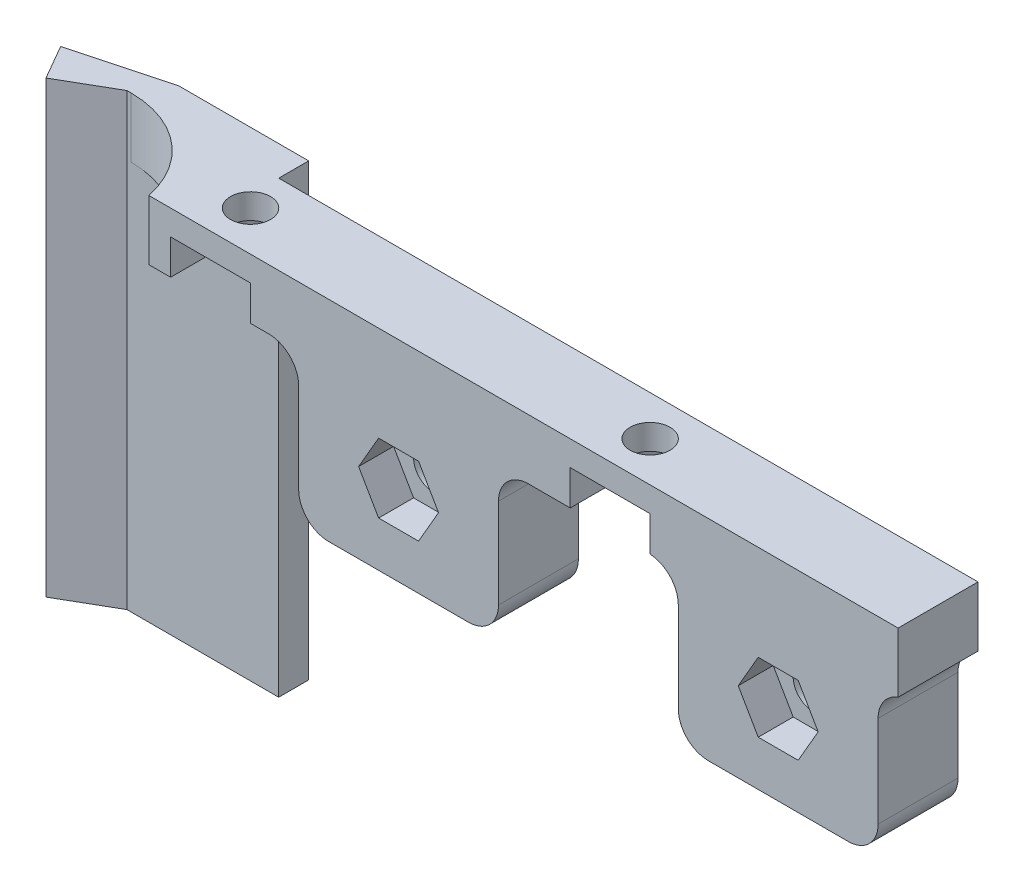
from build123d import *

# Parameters (mm, degrees)
ESQUISSE1_R             = 2
BOSS_EXTRU_1_DEPTH      = 45
ESQUISSE2_W             = 75
ESQUISSE2_H             = 39
ENL_V_MAT_EXTRU_1_DEPTH = 8
ENL_V_MAT_EXTRU_2_DEPTH = 3.5
CONG_1_R                = 10
ESQUISSE4_W             = 20
ESQUISSE4_H             = 8
BOSS_EXTRU_2_DEPTH      = 15
CONG_3_R                = 3
ENL_V_MAT_EXTRU_3_DEPTH = 3.5
ESQUISSE6_R             = 2
ENL_V_MAT_EXTRU_4_DEPTH = 91.936473524


with BuildPart() as part:
    # Esquisse1 → Boss.-Extru.1 (new body)
    with BuildSketch(Plane(origin=(0, 0, 0), x_dir=(1, 0, 0), z_dir=(0, 1, 0))):
        Polygon((-13.665063509, 0.5), (-11.665063509, -2.964101615), (-6.531088913, 0), (3.665063509, 0), (3.665063509, -8), (78.665063509, -8), (78.665063509, 0), (8.665063509, 0), (8.665063509, 3), (-4.334936491, 3), align=None)
        with Locations(Location((49.844555434, -4, 0), (0, 0, 90))):
            Circle(ESQUISSE1_R, mode=Mode.SUBTRACT)
        with Locations(Location((9.844555434, -4, 0), (0, 0, 90))):
            Circle(ESQUISSE1_R, mode=Mode.SUBTRACT)
    extrude(amount=BOSS_EXTRU_1_DEPTH)

    # Esquisse2 → Enlèv. mat.-Extru.1 (cut)
    with BuildSketch(Plane.XY.offset(8)):
        with Locations((41.165063509, 19.5)):
            Rectangle(ESQUISSE2_W, ESQUISSE2_H)
    extrude(amount=-ENL_V_MAT_EXTRU_1_DEPTH, mode=Mode.SUBTRACT)

    # Esquisse3 → Enlèv. mat.-Extru.2 (cut)
    with BuildSketch(Plane.XZ.offset(-39)):
        Polygon((51.844555434, 0.535898385), (47.844555434, 0.535898385), (45.844555434, 4), (45.844555434, 8), (53.844555434, 8), (53.844555434, 4), align=None)
        Polygon((11.844555434, 0.535898385), (7.844555434, 0.535898385), (5.844555434, 4), (5.844555434, 8), (13.844555434, 8), (13.844555434, 4), align=None)
    extrude(amount=-ENL_V_MAT_EXTRU_2_DEPTH, mode=Mode.SUBTRACT)

    # Congé1
    # the kernel refuses this fillet: 10 mm, written as the material it adds along each edge
    with BuildSketch(Plane(origin=(3.665063509, 39, 0), x_dir=(-1, 0, 0), z_dir=(0, 1, 0))) as cong_1_piece_1:
        with BuildLine():
            CenterArc((9.797958971, 10), CONG_1_R, 191.536959033, 78.463040967)
            Line((0, 8), (-0.195959179, 7.96))
            ThreePointArc((-0.195959179, 7.96), (-0.2, 4), (-0.2, 0))
            Line((-0.2, 0), (0, -0.2))
            Line((0, -0.2), (9.797958971, -0.2))
            Line((9.797958971, -0.2), (9.797958971, 0))
        make_face()
    extrude(amount=6)

    # Esquisse4 → Boss.-Extru.2 (add)
    with BuildSketch(Plane.XZ.offset(-39)):
        with Locations((28.665063509, 4)):
            Rectangle(ESQUISSE4_W, ESQUISSE4_H)
        with Locations((66.665063509, 4)):
            Rectangle(ESQUISSE4_W, ESQUISSE4_H)
    extrude(amount=BOSS_EXTRU_2_DEPTH)

    # Congé3
    # the kernel refuses this fillet: 3 mm, written as the material it adds along each edge
    with BuildSketch(Plane(origin=(18.665063509, 39, 0), x_dir=(-1, 0, 0), z_dir=(0, 0, 1)), Plane(origin=(38.665063509, 39, 8), x_dir=(1, 0, 0), z_dir=(0, 0, -1))) as cong_3_piece_1:
        with BuildLine():
            CenterArc((CONG_3_R, CONG_3_R), CONG_3_R, 180, 90)
            Line((0, CONG_3_R), (0, 0))
            Line((0, 0), (CONG_3_R, 0))
        make_face()
    extrude(amount=8)
    with BuildSketch(Plane(origin=(76.665063509, 39, 8), x_dir=(1, 0, 0), z_dir=(0, 0, -1))) as cong_3_piece_2:
        with BuildLine():
            CenterArc((3, 2.828427125), CONG_3_R, 180, 70.528779366)
            Line((0, 2.828427125), (0, 0))
            Line((0, 0), (2, 0))
        make_face()
    extrude(amount=8)
    with BuildSketch(Plane(origin=(56.665063509, 39, 0), x_dir=(-1, 0, 0), z_dir=(0, 0, 1))) as cong_3_piece_3_section:
        with BuildLine():
            CenterArc((CONG_3_R, CONG_3_R), CONG_3_R, 180, 90)
            Line((0, CONG_3_R), (0, 0))
            Line((0, 0), (CONG_3_R, 0))
        make_face()
    cong_3_piece_3 = extrude(amount=8, mode=Mode.PRIVATE)
    cong_3_piece_3 = split(cong_3_piece_3, bisect_by=Plane(origin=(52.817631645, 39, 2.221315823), z_dir=(0.8660254037844395, 0, -0.4999999999999987)), keep=Keep.TOP, mode=Mode.PRIVATE)
    add(cong_3_piece_3)
    with BuildSketch(Plane(origin=(56.665063509, 39, -7.5), x_dir=(-1, 0, 0), z_dir=(0, 0, 1))) as cong_3_piece_4_section:
        with BuildLine():
            CenterArc((CONG_3_R, CONG_3_R), CONG_3_R, 180, 90)
            Line((0, CONG_3_R), (0, 0))
            Line((0, 0), (CONG_3_R, 0))
        make_face()
    cong_3_piece_4 = extrude(amount=15.5, mode=Mode.PRIVATE)
    cong_3_piece_4 = split(cong_3_piece_4, bisect_by=Plane(origin=(53.844555434, 39, -7.5), z_dir=(1, 0, 0)), keep=Keep.TOP, mode=Mode.PRIVATE)
    cong_3_piece_4 = split(cong_3_piece_4, bisect_by=Plane(origin=(49.570036381, 39, -3.403684177), z_dir=(-0.8660254037844395, 0, 0.4999999999999987)), keep=Keep.TOP, mode=Mode.PRIVATE)
    add(cong_3_piece_4)
    # the kernel refuses this fillet: 3 mm, written as the material it takes off along each edge
    with BuildSketch(Plane(origin=(76.665063509, 24, 15.5), x_dir=(-1, 0, 0), z_dir=(0, 0, -1)), Plane(origin=(18.665063509, 24, -7.5), x_dir=(1, 0, 0), z_dir=(0, 0, 1))) as cong_3_2_piece_1:
        with BuildLine():
            CenterArc((CONG_3_R, CONG_3_R), CONG_3_R, 180, 90)
            Line((0, CONG_3_R), (0, 0))
            Line((0, 0), (CONG_3_R, 0))
        make_face()
    extrude(amount=23, mode=Mode.SUBTRACT)
    with BuildSketch(Plane(origin=(56.665063509, 24, -7.5), x_dir=(0, 1, 0), z_dir=(0, 0, 1)), Plane(origin=(38.665063509, 24, 15.5), x_dir=(0, 1, 0), z_dir=(0, 0, -1))) as cong_3_2_piece_2:
        with BuildLine():
            CenterArc((CONG_3_R, -CONG_3_R), CONG_3_R, 90, 90)
            Line((0, -CONG_3_R), (0, 0))
            Line((0, 0), (CONG_3_R, 0))
        make_face()
    extrude(amount=23, mode=Mode.SUBTRACT)

    # Esquisse5 → Enlèv. mat.-Extru.3 (cut)
    with BuildSketch(Plane.XY.offset(8)):
        Polygon((32.665063509, 32), (30.665063509, 28.535898385), (26.665063509, 28.535898385), (24.665063509, 32), (26.665063509, 35.464101615), (30.665063509, 35.464101615), align=None)
        Polygon((70.665063509, 32), (68.665063509, 28.535898385), (64.665063509, 28.535898385), (62.665063509, 32), (64.665063509, 35.464101615), (68.665063509, 35.464101615), align=None)
    extrude(amount=-ENL_V_MAT_EXTRU_3_DEPTH, mode=Mode.SUBTRACT)

    # Esquisse6 → Enlèv. mat.-Extru.4 (cut, through all)
    with BuildSketch(Plane.XY.offset(4.5)):
        with Locations((28.665063509, 32)):
            Circle(ESQUISSE6_R)
        with Locations((66.665063509, 32)):
            Circle(ESQUISSE6_R)
    extrude(amount=-ENL_V_MAT_EXTRU_4_DEPTH, mode=Mode.SUBTRACT)


solid = part.part
